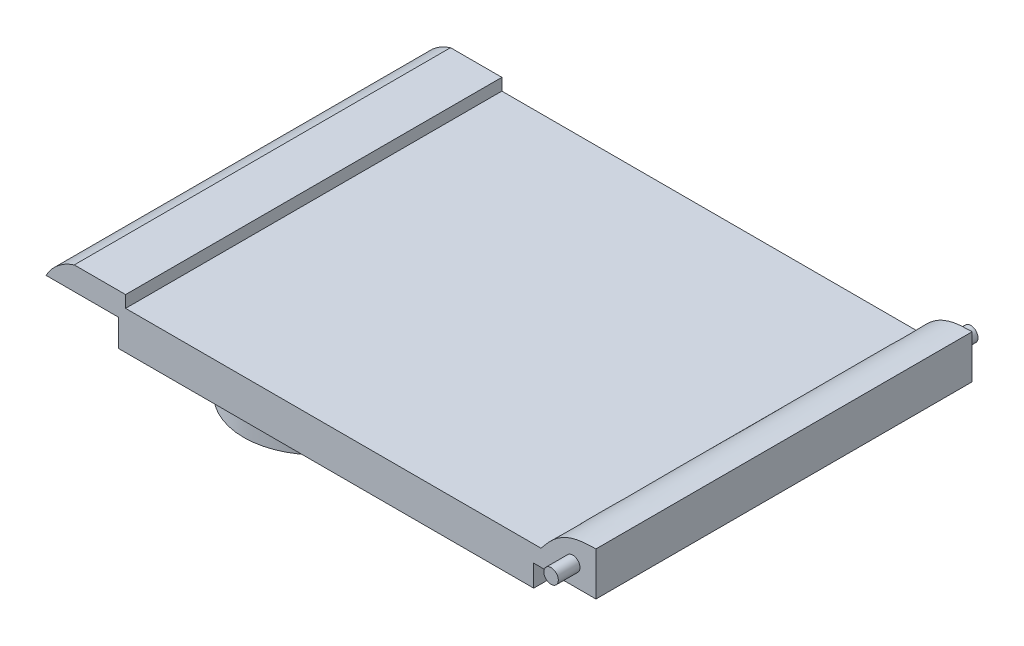
from build123d import *

# Parameters (mm, degrees)
BOSS_EXTRUDE3_DEPTH = 26
FILLET6_START       = -1
FILLET6_DEPTH       = 28
BOSS_EXTRUDE5_DEPTH = 4
SKETCH6_R           = 0.5
BOSS_EXTRUDE6_DEPTH = 1.5
LPATTERN1_COUNT     = 2
LPATTERN1_PITCH     = 27.5


with BuildPart() as part:
    # Sketch4 → Boss-Extrude3 (new body)
    with BuildSketch(Plane.XY):
        with BuildLine():
            Line((-18.782676832, -0.738323828), (9.917323168, -0.738323828))
            Line((9.917323168, -0.738323828), (9.917323168, 0.761676172))
            Line((9.917323168, 0.761676172), (14.217323168, 0.761676172))
            Line((14.217323168, 0.761676172), (14.217323168, 3.761676172))
            Line((14.217323168, 3.761676172), (10.417323168, 3.761676172))
            Line((10.417323168, 3.761676172), (10.417323168, 1.907320096))
            Line((10.417323168, 1.907320096), (-18.282676832, 1.907320096))
            Line((-18.282676832, 1.907320096), (-18.282676832, 2.732812963))
            Line((-18.282676832, 2.732812963), (-21.829938074, 2.732812963))
            ThreePointArc((-21.829938074, 2.732812963), (-22.961793852, 2.121559656), (-23.782676832, 1.131166179))
            Line((-23.782676832, 1.131166179), (-18.782676832, 1.131166179))
            Line((-18.782676832, 1.131166179), (-18.782676832, -0.738323828))
        make_face()
    extrude(amount=BOSS_EXTRUDE3_DEPTH)

    # Fillet6: read off the stored shape, not the designer's step
    # Fillet6 outline → Fillet6 (cut)
    with BuildSketch(Plane.XY.offset(FILLET6_START)):
        with BuildLine():
            Line((10.417323168, 3.761676172), (10.417323168, 1.907320096))
            add(Edge.make_bspline(
                [(10.417323168, 1.907320096), (10.684335221, 2.237350554), (10.951347275, 2.567381012), (11.617088855, 3.247333717), (12.422778443, 3.640500924), (13.36841604, 3.74688263), (13.792869604, 3.754279401), (14.217323168, 3.761676172)],
                knots=[0, 0, 0, 0, 0, 0, 0.5, 0.5, 1, 1, 1, 1, 1, 1], degree=5))
            Line((14.217323168, 3.761676172), (10.417323168, 3.761676172))
        make_face()
    extrude(amount=FILLET6_DEPTH, mode=Mode.SUBTRACT)

    # Sketch5 → Boss-Extrude5 (add)
    with BuildSketch(Plane(origin=(0, -0.738323828, 0), x_dir=(-1, 0, 0), z_dir=(0, -1, 0))):
        with BuildLine():
            Line((18.120676832, -8), (18.120676832, -18))
            ThreePointArc((18.120676832, -18), (13.120676832, -23), (8.120676832, -18))
            Line((8.120676832, -18), (8.120676832, -8))
            ThreePointArc((8.120676832, -8), (13.120676832, -3), (18.120676832, -8))
        make_face()
    extrude(amount=BOSS_EXTRUDE5_DEPTH)

    # Sketch6 → Boss-Extrude6 (add)
    with BuildSketch(Plane.XY.offset(26)):
        with Locations(Location((12.617323168, 2.091676172, 0), (0, 0, 180))):
            Circle(SKETCH6_R)
    boss_extrude6 = extrude(amount=BOSS_EXTRUDE6_DEPTH)

    # LPattern1: Boss-Extrude6 ×2
    with Locations(*[(0, 0, -i * LPATTERN1_PITCH) for i in range(1, LPATTERN1_COUNT)]):
        add(boss_extrude6)


solid = part.part
